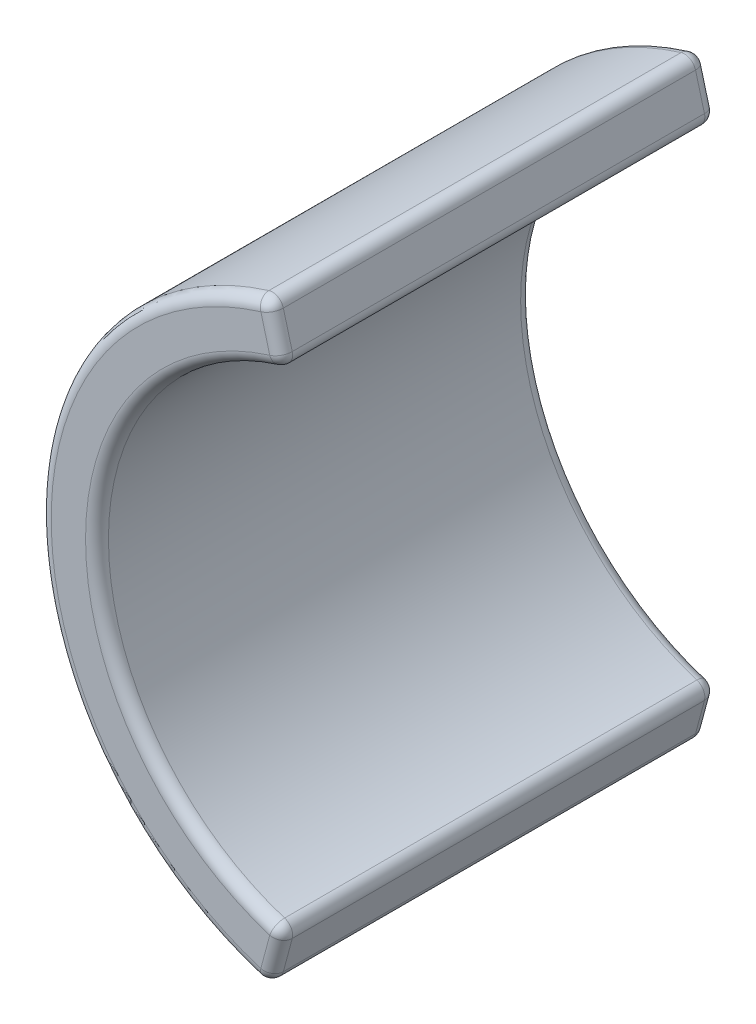
from build123d import *

# Parameters (mm, degrees)
REVOLVE1_START = -9.5
REVOLVE1_DEPTH = 19
FILLET1_R      = 0.5


# Read off the part's stored shape, not the designer's step: Revolve1
with BuildPart() as part:
    # Revolve1 outline → Revolve1 (new body)
    with BuildSketch(Plane.XY.offset(REVOLVE1_START)):
        with BuildLine():
            Line((-2.847009496, 10.625184089), (-3.494057109, 13.039998655))
            ThreePointArc((-3.494057109, 13.039998655), (-13.5, 0), (-3.494057109, -13.039998655))
            Line((-3.494057109, -13.039998655), (-2.847009496, -10.625184089))
            ThreePointArc((-2.847009496, -10.625184089), (-11, 0), (-2.847009496, 10.625184089))
        make_face()
    extrude(amount=REVOLVE1_DEPTH)

    # Fillet1
    fillet1_edges = [part.edges().sort_by_distance(p)[0] for p in [
        (-2.847009496, 10.625184089, 0),
        (-3.170533302, 11.832591372, -9.5),
        (-3.170533302, -11.832591372, -9.5),
        (-3.494057109, -13.039998655, 0),
        (-3.170533302, -11.832591372, 9.5),
        (-2.847009496, -10.625184089, 0),
        (-3.494057109, 13.039998655, 0),
        (-13.5, 0, -9.5),
        (-11, 0, -9.5),
        (-11, 0, 9.5),
        (-13.5, 0, 9.5),
        (-3.170533302, 11.832591372, 9.5),
    ]]
    fillet(fillet1_edges, radius=FILLET1_R)


solid = part.part
